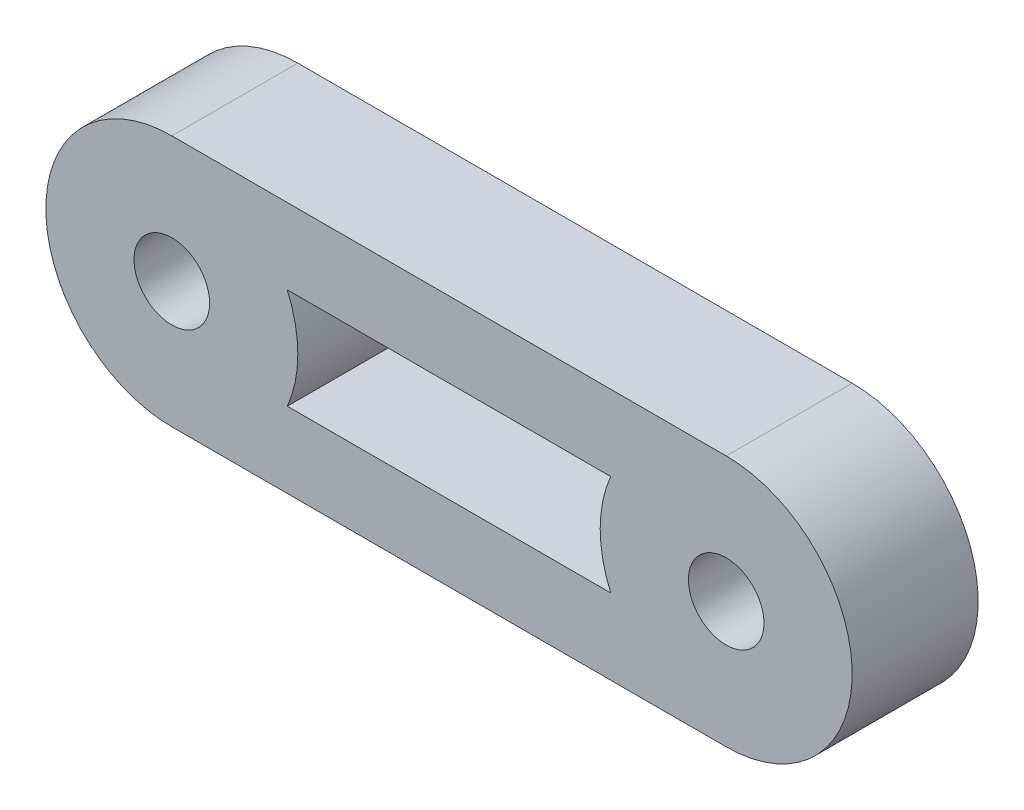
from build123d import *

# Parameters (mm, degrees)
SKETCH1_R          = 1.5
EXTRUDE1_DEPTH     = 5
CUT_EXTRUDE1_START = -10
CUT_EXTRUDE1_DEPTH = 10


with BuildPart() as part:
    # Sketch1 → Extrude1 (new body)
    with BuildSketch(Plane.XY):
        with BuildLine():
            ThreePointArc((0, 5), (-5, 0), (0, -5))
            Line((0, -5), (22, -5))
            ThreePointArc((22, -5), (27, 0), (22, 5))
            Line((22, 5), (0, 5))
        make_face()
        Circle(SKETCH1_R, mode=Mode.SUBTRACT)
        with BuildLine():
            ThreePointArc((23.5, 0), (22, -1.5), (20.5, 0))
            ThreePointArc((20.5, 0), (22, 1.5), (23.5, 0))
        make_face(mode=Mode.SUBTRACT)
    extrude(amount=EXTRUDE1_DEPTH)

    # Sketch2 → Cut-Extrude1 (cut)
    with BuildSketch(Plane.XY.offset(5).offset(CUT_EXTRUDE1_START)):
        with BuildLine():
            Line((4.582575695, -2), (17.417424305, -2))
            ThreePointArc((17.417424305, -2), (17, 0), (17.417424305, 2))
            Line((17.417424305, 2), (4.582575695, 2))
            ThreePointArc((4.582575695, 2), (5, 0), (4.582575695, -2))
        make_face()
    extrude(amount=CUT_EXTRUDE1_DEPTH, mode=Mode.SUBTRACT)


solid = part.part
